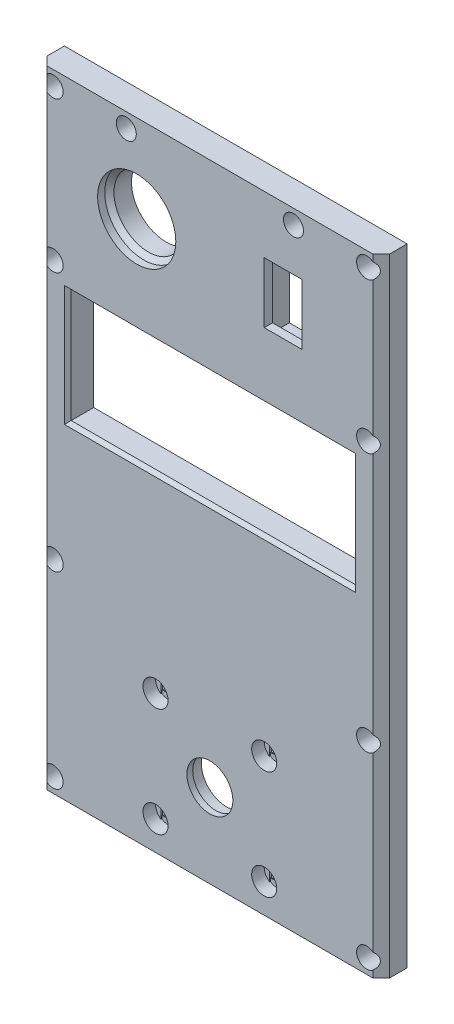
from build123d import *

# Parameters (mm, degrees)
SKETCH1_W           = 82
SKETCH1_H           = 150
SKETCH1_W_2         = 68
SKETCH1_H_2         = 136
BOSS_EXTRUDE1_DEPTH = 7
SKETCH2_W           = 68
SKETCH2_H           = 36
BOSS_EXTRUDE2_DEPTH = 7
SKETCH3_R           = 5.5
CUT_EXTRUDE1_DEPTH  = 86.761296632
SKETCH4_R           = 6.05
CUT_EXTRUDE2_DEPTH  = 5.6
SKETCH5_R           = 11
CUT_EXTRUDE3_DEPTH  = 3
SKETCH6_R           = 1.7
CUT_EXTRUDE4_DEPTH  = 86.761296632
SKETCH7_W           = 50
SKETCH7_H           = 38
CUT_EXTRUDE5_DEPTH  = 1
SKETCH8_R           = 3
CUT_EXTRUDE6_DEPTH  = 3
SKETCH9_R           = 1.45
CUT_EXTRUDE7_DEPTH  = 86.761296632
SKETCH10_R          = 2.4
CUT_EXTRUDE8_DEPTH  = 5
CHAMFER1_SIZE       = 2
SKETCH11_W          = 68
SKETCH11_H          = 35.6
BOSS_EXTRUDE3_DEPTH = 7
SKETCH12_R          = 1.45
CUT_EXTRUDE9_DEPTH  = 86.761296632
SKETCH13_R          = 2.4
CUT_EXTRUDE10_DEPTH = 5
CHAMFER2_SIZE       = 0.8
CUT_EXTRUDE11_DEPTH = 0.2
SKETCH15_W          = 2.9
SKETCH15_H          = 2.9
CUT_EXTRUDE12_DEPTH = 0.2
CUT_EXTRUDE13_DEPTH = 0.2
SKETCH17_W          = 3.4
SKETCH17_H          = 3.4
CUT_EXTRUDE14_DEPTH = 0.2
BOSS_EXTRUDE4_START = -7
SKETCH18_W          = 69.6
SKETCH18_H          = 38
BOSS_EXTRUDE4_DEPTH = 7
CHAMFER3_SIZE       = 0.8
SKETCH19_R          = 8.25
SKETCH19_W          = 9
SKETCH19_H          = 14.5
CUT_EXTRUDE15_DEPTH = 86.761296632
SKETCH20_W          = 11
SKETCH20_H          = 20.5
CUT_EXTRUDE16_DEPTH = 5
SKETCH21_R          = 9.35
CUT_EXTRUDE17_DEPTH = 1.6
CHAMFER4_SIZE       = 1.2


with BuildPart() as part:
    # Sketch1 → Boss-Extrude1 (new body)
    with BuildSketch(Plane.XY):
        Rectangle(SKETCH1_W, SKETCH1_H)
        Rectangle(SKETCH1_W_2, SKETCH1_H_2, mode=Mode.SUBTRACT)
    extrude(amount=BOSS_EXTRUDE1_DEPTH)

    # Sketch2 → Boss-Extrude2 (add)
    with BuildSketch(Plane.XY.offset(7)):
        with Locations((0, -50)):
            Rectangle(SKETCH2_W, SKETCH2_H)
    extrude(amount=-BOSS_EXTRUDE2_DEPTH)

    # Sketch3 → Cut-Extrude1 (cut, through all)
    with BuildSketch(Plane(origin=(0, 0, 0), x_dir=(-1, 0, 0), z_dir=(0, 0, -1))):
        with Locations((0, -55)):
            Circle(SKETCH3_R)
    extrude(amount=-CUT_EXTRUDE1_DEPTH, mode=Mode.SUBTRACT)

    # Sketch4 → Cut-Extrude2 (cut)
    with BuildSketch(Plane(origin=(0, 0, 0), x_dir=(-1, 0, 0), z_dir=(0, 0, -1))):
        with Locations((0, -55)):
            Circle(SKETCH4_R)
    extrude(amount=-CUT_EXTRUDE2_DEPTH, mode=Mode.SUBTRACT)

    # Sketch5 → Cut-Extrude3 (cut)
    with BuildSketch(Plane(origin=(0, 0, 0), x_dir=(-1, 0, 0), z_dir=(0, 0, -1))):
        with Locations((0, -55)):
            Circle(SKETCH5_R)
    extrude(amount=-CUT_EXTRUDE3_DEPTH, mode=Mode.SUBTRACT)

    # Sketch6 → Cut-Extrude4 (cut, through all)
    with BuildSketch(Plane(origin=(0, 0, 0), x_dir=(-1, 0, 0), z_dir=(0, 0, -1))):
        with Locations((-13, -42)):
            Circle(SKETCH6_R)
        with Locations((13, -42)):
            Circle(SKETCH6_R)
        with Locations((13, -68)):
            Circle(SKETCH6_R)
        with Locations((-13, -68)):
            Circle(SKETCH6_R)
    extrude(amount=-CUT_EXTRUDE4_DEPTH, mode=Mode.SUBTRACT)

    # Sketch7 → Cut-Extrude5 (cut)
    with BuildSketch(Plane(origin=(0, 0, 0), x_dir=(-1, 0, 0), z_dir=(0, 0, -1))):
        with Locations((0, -55)):
            Rectangle(SKETCH7_W, SKETCH7_H)
    extrude(amount=-CUT_EXTRUDE5_DEPTH, mode=Mode.SUBTRACT)

    # Sketch8 → Cut-Extrude6 (cut)
    with BuildSketch(Plane.XY.offset(7)):
        with Locations((-13, -42)):
            Circle(SKETCH8_R)
        with Locations((13, -42)):
            Circle(SKETCH8_R)
        with Locations((13, -68)):
            Circle(SKETCH8_R)
        with Locations((-13, -68)):
            Circle(SKETCH8_R)
    extrude(amount=-CUT_EXTRUDE6_DEPTH, mode=Mode.SUBTRACT)

    # Sketch9 → Cut-Extrude7 (cut, through all)
    with BuildSketch(Plane.XY.offset(7)):
        with Locations((-37.5, 71.5)):
            Circle(SKETCH9_R)
        with Locations((37.5, 71.5)):
            Circle(SKETCH9_R)
        with Locations((-37.5, -71.5)):
            Circle(SKETCH9_R)
        with Locations((37.5, -71.5)):
            Circle(SKETCH9_R)
        with Locations((-37.5, 35.5)):
            Circle(SKETCH9_R)
        with Locations((37.5, 35.5)):
            Circle(SKETCH9_R)
        with Locations((37.5, -26.5)):
            Circle(SKETCH9_R)
        with Locations((-37.5, -26.5)):
            Circle(SKETCH9_R)
    extrude(amount=-CUT_EXTRUDE7_DEPTH, mode=Mode.SUBTRACT)

    # Sketch10 → Cut-Extrude8 (cut)
    with BuildSketch(Plane.XY.offset(7)):
        with Locations((-37.5, 71.5)):
            Circle(SKETCH10_R)
        with Locations((37.5, 35.5)):
            Circle(SKETCH10_R)
        with Locations((-37.5, 35.5)):
            Circle(SKETCH10_R)
        with Locations((37.5, 71.5)):
            Circle(SKETCH10_R)
        with Locations((-37.5, -71.5)):
            Circle(SKETCH10_R)
        with Locations((37.5, -71.5)):
            Circle(SKETCH10_R)
        with Locations((-37.5, -26.5)):
            Circle(SKETCH10_R)
        with Locations((37.5, -26.5)):
            Circle(SKETCH10_R)
    extrude(amount=-CUT_EXTRUDE8_DEPTH, mode=Mode.SUBTRACT)

    # Chamfer1
    # the kernel refuses this chamfer: 2 mm, written as the material it takes off along each edge
    with BuildSketch(Plane(origin=(-41, 80.143365976, 7), x_dir=(-0.027495876610585623, 0, -0.9996219169112968), z_dir=(0, -1, 0)), Plane(origin=(41, -80.143365976, 7), x_dir=(0.027495876610585623, 0, -0.9996219169112968), z_dir=(0, 1, 0))) as chamfer1_piece_1:
        Polygon((CHAMFER1_SIZE * 0.999621916911, CHAMFER1_SIZE * 0.0274958766106), (-CHAMFER1_SIZE * 0.0274958766106, CHAMFER1_SIZE * 0.999621916911), (0, 0), align=None)
    extrude(amount=160.286731952, mode=Mode.SUBTRACT)

    # Sketch11 → Boss-Extrude3 (add)
    with BuildSketch(Plane.XY.offset(7)):
        with Locations((0, -14.2)):
            Rectangle(SKETCH11_W, SKETCH11_H)
    extrude(amount=-BOSS_EXTRUDE3_DEPTH)

    # Sketch12 → Cut-Extrude9 (cut, through all)
    with BuildSketch(Plane.XY.offset(7)):
        with Locations((-20, 71.5)):
            Circle(SKETCH12_R)
        with Locations((20, 71.5)):
            Circle(SKETCH12_R)
    extrude(amount=-CUT_EXTRUDE9_DEPTH, mode=Mode.SUBTRACT)

    # Sketch13 → Cut-Extrude10 (cut)
    with BuildSketch(Plane.XY.offset(7)):
        with Locations((-20, 71.5)):
            Circle(SKETCH13_R)
        with Locations((20, 71.5)):
            Circle(SKETCH13_R)
    extrude(amount=-CUT_EXTRUDE10_DEPTH, mode=Mode.SUBTRACT)

    # Chamfer2
    chamfer2_edges = [part.edges().sort_by_distance(p)[0] for p in [
        (0, 68, 0),
        (-34, 35.8, 0),
        (0, 68, 7),
        (-34, 35.8, 7),
        (34, 35.8, 7),
        (34, 35.8, 0),
        (0, 3.6, 7),
        (0, 3.6, 0),
        (0, -75, 0),
        (-41, 0, 0),
        (0, 75, 0),
        (41, 0, 0),
    ]]
    chamfer(chamfer2_edges, length=CHAMFER2_SIZE)

    # Sketch14 → Cut-Extrude11 (cut)
    with BuildSketch(Plane.XY.offset(2)):
        with BuildLine():
            Line((-38.95, -28.41245915), (-38.95, -24.58754085))
            ThreePointArc((-38.95, -24.58754085), (-37.5, -24.1), (-36.05, -24.58754085))
            Line((-36.05, -24.58754085), (-36.05, -28.41245915))
            ThreePointArc((-36.05, -28.41245915), (-37.5, -28.9), (-38.95, -28.41245915))
        make_face()
        with BuildLine():
            Line((-38.95, -73.41245915), (-38.95, -69.58754085))
            ThreePointArc((-38.95, -69.58754085), (-37.5, -69.1), (-36.05, -69.58754085))
            Line((-36.05, -69.58754085), (-36.05, -73.41245915))
            ThreePointArc((-36.05, -73.41245915), (-37.5, -73.9), (-38.95, -73.41245915))
        make_face()
        with BuildLine():
            Line((-38.95, 33.58754085), (-38.95, 37.41245915))
            ThreePointArc((-38.95, 37.41245915), (-37.5, 37.9), (-36.05, 37.41245915))
            Line((-36.05, 37.41245915), (-36.05, 33.58754085))
            ThreePointArc((-36.05, 33.58754085), (-37.5, 33.1), (-38.95, 33.58754085))
        make_face()
        with BuildLine():
            Line((-21.45, 69.58754085), (-21.45, 73.41245915))
            ThreePointArc((-21.45, 73.41245915), (-20, 73.9), (-18.55, 73.41245915))
            Line((-18.55, 73.41245915), (-18.55, 69.58754085))
            ThreePointArc((-18.55, 69.58754085), (-20, 69.1), (-21.45, 69.58754085))
        make_face()
        with BuildLine():
            Line((-38.95, 69.58754085), (-38.95, 73.41245915))
            ThreePointArc((-38.95, 73.41245915), (-37.5, 73.9), (-36.05, 73.41245915))
            Line((-36.05, 73.41245915), (-36.05, 69.58754085))
            ThreePointArc((-36.05, 69.58754085), (-37.5, 69.1), (-38.95, 69.58754085))
        make_face()
    cut_extrude11 = extrude(amount=-CUT_EXTRUDE11_DEPTH, mode=Mode.SUBTRACT)

    # Sketch15 → Cut-Extrude12 (cut)
    with BuildSketch(Plane.XY.offset(1.8)):
        with Locations((-37.5, -71.5)):
            Rectangle(SKETCH15_W, SKETCH15_H)
        with Locations((-37.5, -26.5)):
            Rectangle(SKETCH15_W, SKETCH15_H)
        with Locations((-37.5, 35.5)):
            Rectangle(SKETCH15_W, SKETCH15_H)
        with Locations((-37.5, 71.5)):
            Rectangle(SKETCH15_W, SKETCH15_H)
        with Locations((-20, 71.5)):
            Rectangle(SKETCH15_W, SKETCH15_H)
    cut_extrude12 = extrude(amount=-CUT_EXTRUDE12_DEPTH, mode=Mode.SUBTRACT)

    # Sketch16 → Cut-Extrude13 (cut)
    with BuildSketch(Plane.XY.offset(4)):
        with BuildLine():
            Line((-14.7, -44.471841419), (-14.7, -39.528158581))
            ThreePointArc((-14.7, -39.528158581), (-13, -39), (-11.3, -39.528158581))
            Line((-11.3, -39.528158581), (-11.3, -44.471841419))
            ThreePointArc((-11.3, -44.471841419), (-13, -45), (-14.7, -44.471841419))
        make_face()
        with BuildLine():
            Line((-14.7, -70.471841419), (-14.7, -65.528158581))
            ThreePointArc((-14.7, -65.528158581), (-13, -65), (-11.3, -65.528158581))
            Line((-11.3, -65.528158581), (-11.3, -70.471841419))
            ThreePointArc((-11.3, -70.471841419), (-13, -71), (-14.7, -70.471841419))
        make_face()
    cut_extrude13 = extrude(amount=-CUT_EXTRUDE13_DEPTH, mode=Mode.SUBTRACT)

    # Sketch17 → Cut-Extrude14 (cut)
    with BuildSketch(Plane.XY.offset(3.8)):
        with Locations((-13, -42)):
            Rectangle(SKETCH17_W, SKETCH17_H)
        with Locations((-13, -68)):
            Rectangle(SKETCH17_W, SKETCH17_H)
    cut_extrude14 = extrude(amount=-CUT_EXTRUDE14_DEPTH, mode=Mode.SUBTRACT)

    # Mirror1: Cut-Extrude11, Cut-Extrude12, Cut-Extrude13, Cut-Extrude14 across plane
    add(cut_extrude11.mirror(Plane(origin=(0, 0, 0), x_dir=(0, 0, 1), z_dir=(1, 0, 0))), mode=Mode.SUBTRACT)
    add(cut_extrude12.mirror(Plane(origin=(0, 0, 0), x_dir=(0, 0, 1), z_dir=(1, 0, 0))), mode=Mode.SUBTRACT)
    add(cut_extrude13.mirror(Plane(origin=(0, 0, 0), x_dir=(0, 0, 1), z_dir=(1, 0, 0))), mode=Mode.SUBTRACT)
    add(cut_extrude14.mirror(Plane(origin=(0, 0, 0), x_dir=(0, 0, 1), z_dir=(1, 0, 0))), mode=Mode.SUBTRACT)

    # Sketch18 → Boss-Extrude4 (add)
    with BuildSketch(Plane.XY.offset(7).offset(BOSS_EXTRUDE4_START)):
        with Locations((0, 49.8)):
            Rectangle(SKETCH18_W, SKETCH18_H)
    extrude(amount=BOSS_EXTRUDE4_DEPTH)

    # Chamfer3
    chamfer3_edges = [part.edges().sort_by_distance(p)[0] for p in [
        (0, 30.8, 7),
    ]]
    chamfer(chamfer3_edges, length=CHAMFER3_SIZE)

    # Sketch19 → Cut-Extrude15 (cut, through all)
    with BuildSketch(Plane.XY.offset(7)):
        with Locations((-17.5, 54)):
            Circle(SKETCH19_R)
        with Locations((17.5, 54)):
            Rectangle(SKETCH19_W, SKETCH19_H)
    extrude(amount=-CUT_EXTRUDE15_DEPTH, mode=Mode.SUBTRACT)

    # Sketch20 → Cut-Extrude16 (cut)
    with BuildSketch(Plane(origin=(0, 0, 0), x_dir=(-1, 0, 0), z_dir=(0, 0, -1))):
        with Locations((-17.5, 54)):
            Rectangle(SKETCH20_W, SKETCH20_H)
    extrude(amount=-CUT_EXTRUDE16_DEPTH, mode=Mode.SUBTRACT)

    # Sketch21 → Cut-Extrude17 (cut)
    with BuildSketch(Plane.XY.offset(7)):
        with Locations((-17.5, 54)):
            Circle(SKETCH21_R)
    extrude(amount=-CUT_EXTRUDE17_DEPTH, mode=Mode.SUBTRACT)

    # Chamfer4
    # the kernel refuses this chamfer: 1.2 mm, written as the material it takes off along each edge
    with BuildSketch(Plane(origin=(-17.5, 54, 5.4), x_dir=(1, 0, 0), z_dir=(0, -1, 0))) as chamfer4_piece_1_section:
        Polygon((8.25 + CHAMFER4_SIZE, 0), (8.25, -CHAMFER4_SIZE), (8.25, 0), align=None)
    chamfer4_piece_1 = revolve(axis=Axis((-17.5, 54, 5.4), (0, 0, 1)), mode=Mode.PRIVATE)
    chamfer4_piece_1 = chamfer4_piece_1 & Plane(origin=(-17.5, 54, 4.757679288), x_dir=(1, 0, 0), z_dir=(0, 0, 1)) * Cylinder(9.35, 38, mode=Mode.PRIVATE)
    add(chamfer4_piece_1, mode=Mode.SUBTRACT)


solid = part.part
